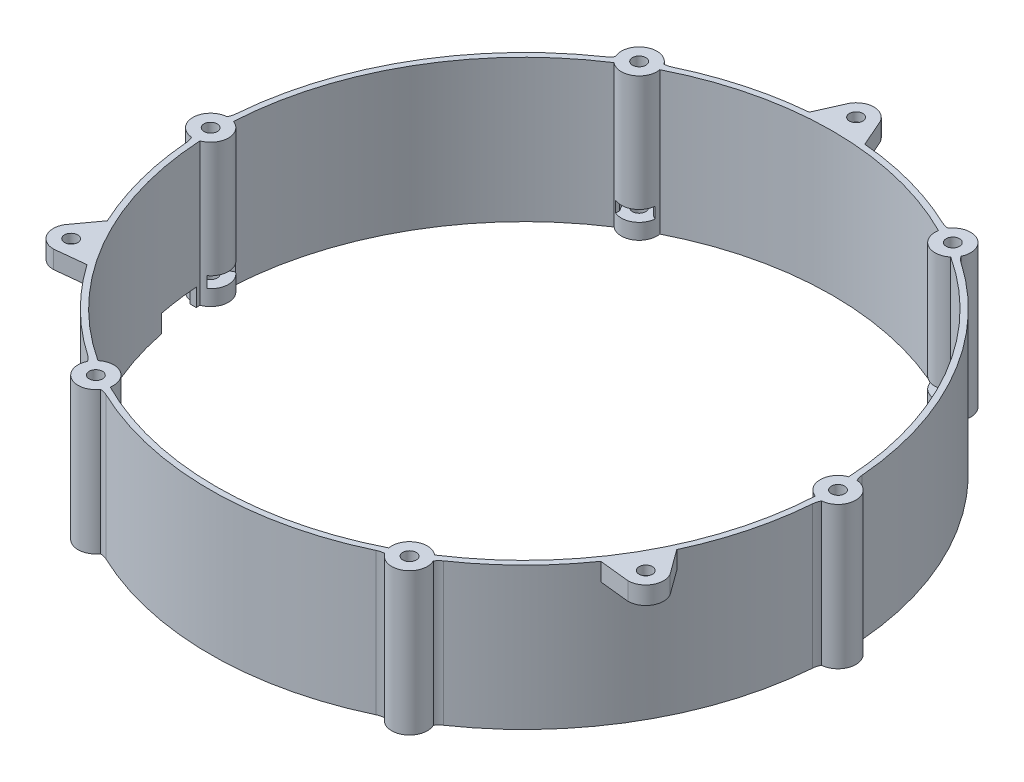
from build123d import *

# Parameters (mm, degrees)
SKETCH_1_R               = 1.5
SKETCH_1_R_2             = 4.5
EXTRUDE_1_DEPTH          = 4
FILLET_1_R               = 4
FILLET_2_R               = 4
EXTRUDE_START            = 5
EXTRUDE_2_DEPTH          = 5
CHAMFER_1_SIZE           = 0.5
EXTRUDE_START_2          = 10
SKETCH_3_R               = 1.5
EXTRUDE_3_DEPTH          = 10
CUT_EXTRUDE_1_DEPTH      = 7
CUT_EXTRUDE_1_DEPTH_BACK = 10
SKETCH_4_W               = 227.71066379
SKETCH_4_H               = 177.705724634
EXTRUDE_4_DEPTH          = 2.5
SKETCH_7_R               = 85.196987133
CUT_EXTRUDE_2_DEPTH      = 6.5
SKETCH_8_R               = 1.5
EXTRUDE_5_DEPTH          = 26
EXTRUDE_START_3          = -28
SKETCH_10_R              = 1.5
EXTRUDE_6_DEPTH          = 4
CUT_EXTRUDE_3_DEPTH      = 2
SKETCH_13_W              = 17.469611324
SKETCH_13_H              = 9
CUT_EXTRUDE_4_DEPTH      = 4


with BuildPart() as part:
    # 草图1 → 凸台-拉伸1 (new body)
    with BuildSketch(Plane(origin=(0, 0, 0), x_dir=(1, 0, 0), z_dir=(0, 1, 0))):
        with BuildLine():
            ThreePointArc((-70.5, 3), (-73.5, 0), (-70.5, -3))
            ThreePointArc((-70.5, -3), (-61.110044183, -35.281900459), (-37.848076211, -59.554790967))
            ThreePointArc((-37.848076211, -59.554790967), (-36.75, -63.652867178), (-32.651923789, -62.554790967))
            ThreePointArc((-32.651923789, -62.554790967), (0, -70.563800918), (32.651923789, -62.554790967))
            ThreePointArc((32.651923789, -62.554790967), (36.75, -63.652867178), (37.848076211, -59.554790967))
            ThreePointArc((37.848076211, -59.554790967), (61.110044183, -35.281900459), (70.5, -3))
            ThreePointArc((70.5, -3), (73.5, 0), (70.5, 3))
            ThreePointArc((70.5, 3), (61.110044183, 35.281900459), (37.848076211, 59.554790967))
            ThreePointArc((37.848076211, 59.554790967), (36.75, 63.652867178), (32.651923789, 62.554790967))
            ThreePointArc((32.651923789, 62.554790967), (0, 70.563800918), (-32.651923789, 62.554790967))
            ThreePointArc((-32.651923789, 62.554790967), (-36.75, 63.652867178), (-37.848076211, 59.554790967))
            ThreePointArc((-37.848076211, 59.554790967), (-61.110044183, 35.281900459), (-70.5, 3))
        make_face()
        with Locations(Location((-8, 0, 0), (0, 0, 270))):
            Circle(SKETCH_1_R, mode=Mode.SUBTRACT)
        with Locations(Location((0, 8, 0), (0, 0, 270))):
            Circle(SKETCH_1_R, mode=Mode.SUBTRACT)
        with Locations(Location((8, 0, 0), (0, 0, 270))):
            Circle(SKETCH_1_R, mode=Mode.SUBTRACT)
        with Locations(Location((0, -8, 0), (0, 0, 270))):
            Circle(SKETCH_1_R, mode=Mode.SUBTRACT)
        with Locations(Location((-70.5, 0, 0), (0, 0, 270))):
            Circle(SKETCH_1_R, mode=Mode.SUBTRACT)
        with Locations(Location((-35.25, 61.054790967, 0), (0, 0, 270))):
            Circle(SKETCH_1_R, mode=Mode.SUBTRACT)
        with Locations(Location((35.25, 61.054790967, 0), (0, 0, 270))):
            Circle(SKETCH_1_R, mode=Mode.SUBTRACT)
        with Locations(Location((70.5, 0, 0), (0, 0, 270))):
            Circle(SKETCH_1_R, mode=Mode.SUBTRACT)
        with Locations(Location((35.25, -61.054790967, 0), (0, 0, 270))):
            Circle(SKETCH_1_R, mode=Mode.SUBTRACT)
        with Locations(Location((-35.25, -61.054790967, 0), (0, 0, 270))):
            Circle(SKETCH_1_R, mode=Mode.SUBTRACT)
        with Locations(Location((0, 0, 0), (0, 0, 270))):
            Circle(SKETCH_1_R_2, mode=Mode.SUBTRACT)
        with BuildLine():
            Line((-9.579036496, 4.300239505), (-67.362882511, 4.300239505))
            ThreePointArc((-67.362882511, 4.300239505), (-58.456714755, 33.75), (-37.405557909, 56.187847774))
            Line((-37.405557909, 56.187847774), (-8.513634902, 6.145569197))
            ThreePointArc((-8.513634902, 6.145569197), (-9.09326674, 5.25), (-9.579036496, 4.300239505))
        make_face(mode=Mode.SUBTRACT)
        with BuildLine():
            Line((-9.579036496, -4.300239505), (-67.362882511, -4.300239505))
            ThreePointArc((-67.362882511, -4.300239505), (-58.456714755, -33.75), (-37.405557909, -56.187847774))
            Line((-37.405557909, -56.187847774), (-8.513634902, -6.145569197))
            ThreePointArc((-8.513634902, -6.145569197), (-9.09326674, -5.25), (-9.579036496, -4.300239505))
        make_face(mode=Mode.SUBTRACT)
        with BuildLine():
            Line((67.362882511, -4.300239505), (9.579036496, -4.300239505))
            ThreePointArc((9.579036496, -4.300239505), (9.09326674, -5.25), (8.513634902, -6.145569197))
            Line((8.513634902, -6.145569197), (37.405557909, -56.187847774))
            ThreePointArc((37.405557909, -56.187847774), (58.456714755, -33.75), (67.362882511, -4.300239505))
        make_face(mode=Mode.SUBTRACT)
        with BuildLine():
            Line((67.362882511, 4.300239505), (9.579036496, 4.300239505))
            ThreePointArc((9.579036496, 4.300239505), (9.09326674, 5.25), (8.513634902, 6.145569197))
            Line((8.513634902, 6.145569197), (37.405557909, 56.187847774))
            ThreePointArc((37.405557909, 56.187847774), (58.456714755, 33.75), (67.362882511, 4.300239505))
        make_face(mode=Mode.SUBTRACT)
        with BuildLine():
            Line((-1.065401594, 10.445808702), (-29.957324602, 60.488087279))
            ThreePointArc((-29.957324602, 60.488087279), (0, 67.5), (29.957324602, 60.488087279))
            Line((29.957324602, 60.488087279), (1.065401594, 10.445808702))
            ThreePointArc((1.065401594, 10.445808702), (0, 10.5), (-1.065401594, 10.445808702))
        make_face(mode=Mode.SUBTRACT)
        with BuildLine():
            Line((29.957324602, -60.488087279), (1.065401594, -10.445808702))
            ThreePointArc((1.065401594, -10.445808702), (0, -10.5), (-1.065401594, -10.445808702))
            Line((-1.065401594, -10.445808702), (-29.957324602, -60.488087279))
            ThreePointArc((-29.957324602, -60.488087279), (0, -67.5), (29.957324602, -60.488087279))
        make_face(mode=Mode.SUBTRACT)
        with BuildLine():
            Line((-32.799038106, -53.809600438), (-7.799038106, -10.508330249))
            ThreePointArc((-7.799038106, -10.508330249), (-5.75, -9.959292144), (-5.200961894, -12.008330249))
            Line((-5.200961894, -12.008330249), (-30.200961894, -55.309600438))
            ThreePointArc((-30.200961894, -55.309600438), (-32.25, -55.858638544), (-32.799038106, -53.809600438))
        make_face(mode=Mode.SUBTRACT)
        with BuildLine():
            Line((-63, 1.5), (-13, 1.5))
            ThreePointArc((-13, 1.5), (-11.5, 0), (-13, -1.5))
            Line((-13, -1.5), (-63, -1.5))
            ThreePointArc((-63, -1.5), (-64.5, 0), (-63, 1.5))
        make_face(mode=Mode.SUBTRACT)
        with BuildLine():
            Line((-30.200961894, 55.309600438), (-5.200961894, 12.008330249))
            ThreePointArc((-5.200961894, 12.008330249), (-5.75, 9.959292144), (-7.799038106, 10.508330249))
            Line((-7.799038106, 10.508330249), (-32.799038106, 53.809600438))
            ThreePointArc((-32.799038106, 53.809600438), (-32.25, 55.858638544), (-30.200961894, 55.309600438))
        make_face(mode=Mode.SUBTRACT)
        with BuildLine():
            Line((32.799038106, 53.809600438), (7.799038106, 10.508330249))
            ThreePointArc((7.799038106, 10.508330249), (5.75, 9.959292144), (5.200961894, 12.008330249))
            Line((5.200961894, 12.008330249), (30.200961894, 55.309600438))
            ThreePointArc((30.200961894, 55.309600438), (32.25, 55.858638544), (32.799038106, 53.809600438))
        make_face(mode=Mode.SUBTRACT)
        with BuildLine():
            Line((63, -1.5), (13, -1.5))
            ThreePointArc((13, -1.5), (11.5, 0), (13, 1.5))
            Line((13, 1.5), (63, 1.5))
            ThreePointArc((63, 1.5), (64.5, 0), (63, -1.5))
        make_face(mode=Mode.SUBTRACT)
        with BuildLine():
            Line((30.200961894, -55.309600438), (5.200961894, -12.008330249))
            ThreePointArc((5.200961894, -12.008330249), (5.75, -9.959292144), (7.799038106, -10.508330249))
            Line((7.799038106, -10.508330249), (32.799038106, -53.809600438))
            ThreePointArc((32.799038106, -53.809600438), (32.25, -55.858638544), (30.200961894, -55.309600438))
        make_face(mode=Mode.SUBTRACT)
    extrude(amount=EXTRUDE_1_DEPTH)

    # 圆角1
    fillet_1_edges = [part.edges().sort_by_distance(p)[0] for p in [
        (-32.651923789, 2, -62.554790967),
        (32.651923789, 2, -62.554790967),
        (37.848076211, 2, -59.554790967),
        (70.5, 2, -3),
        (70.5, 2, 3),
        (37.848076211, 2, 59.554790967),
        (32.651923789, 2, 62.554790967),
        (-32.651923789, 2, 62.554790967),
        (-37.848076211, 2, 59.554790967),
        (-70.5, 2, 3),
        (-70.5, 2, -3),
        (-37.848076211, 2, -59.554790967),
        (29.957324602, 2, 60.488087279),
        (-29.957324602, 2, 60.488087279),
        (67.362882511, 2, 4.300239505),
        (37.405557909, 2, 56.187847774),
        (37.405557909, 2, -56.187847774),
        (67.362882511, 2, -4.300239505),
        (-29.957324602, 2, -60.488087279),
        (29.957324602, 2, -60.488087279),
        (-67.362882511, 2, -4.300239505),
        (-37.405557909, 2, -56.187847774),
        (-67.362882511, 2, 4.300239505),
        (-37.405557909, 2, 56.187847774),
    ]]
    fillet(fillet_1_edges, radius=FILLET_1_R)

    # 圆角2
    # the kernel refuses this fillet: 4 mm, written as the material it adds along each edge
    with BuildSketch(Plane(origin=(-1.065401594, 0, 10.445808702), x_dir=(-0.5000000000000071, 0, 0.8660254037844346), z_dir=(0, 1, 0)), Plane(origin=(-9.579036496, 0, 4.300239505), x_dir=(-1, 0, 0), z_dir=(0, 1, 0)), Plane(origin=(-8.513634902, 0, -6.145569197), x_dir=(-0.4999999999999958, 0, -0.866025403784441), z_dir=(0, 1, 0)), Plane(origin=(1.065401594, 0, -10.445808702), x_dir=(0.5000000000000073, 0, -0.8660254037844344), z_dir=(0, 1, 0)), Plane(origin=(9.579036496, 0, -4.300239505), x_dir=(1, 0, 0), z_dir=(0, 1, 0)), Plane(origin=(8.513634902, 0, 6.145569197), x_dir=(0.4999999999999941, 0, 0.866025403784442), z_dir=(0, 1, 0))) as fillet_2_piece_1:
        with BuildLine():
            CenterArc((2.310287461, 4), FILLET_2_R, 214.919873181, 55.080126819)
            ThreePointArc((-0.969526045, 1.710278757), (-0.444646896, 0.877880484), (0, 0))
            Line((0, 0), (2.310287461, 0))
        make_face()
    extrude(amount=4)
    with BuildSketch(Plane(origin=(-8.513634902, 0, 6.145569197), x_dir=(-0.5068146140540679, 0, -0.8620550718957729), z_dir=(0, 1, 0)), Plane(origin=(-9.579036496, 0, -4.300239505), x_dir=(0.49315428469593503, 0, -0.86994186672791), z_dir=(0, 1, 0)), Plane(origin=(-1.065401594, 0, -10.445808702), x_dir=(0.9999688987499935, 0, -0.007886794832196306), z_dir=(0, 1, 0)), Plane(origin=(8.513634902, 0, -6.145569197), x_dir=(0.5068146140541091, 0, 0.8620550718957487), z_dir=(0, 1, 0)), Plane(origin=(9.579036496, 0, 4.300239505), x_dir=(-0.49315428469592015, 0, 0.8699418667279183), z_dir=(0, 1, 0))) as fillet_2_piece_2:
        with BuildLine():
            CenterArc((2.340439307, 3.982432925), FILLET_2_R, 209.548115257, 55.080126819)
            Line((-1.13932816, 2.009815786), (0, 0))
            ThreePointArc((0, 0), (0.982984509, 0.046113572), (1.965969018, 0))
        make_face()
    extrude(amount=4)
    with BuildSketch(Plane(origin=(1.065401594, 0, 10.445808702), x_dir=(0.4999999999999959, 0, 0.8660254037844409), z_dir=(0, 1, 0))) as fillet_2_piece_3:
        with BuildLine():
            CenterArc((2.310287461, -4), FILLET_2_R, 90, 55.080126819)
            ThreePointArc((-0.969526045, -1.710278757), (-0.444646896, -0.877880484), (0, 0))
            Line((0, 0), (2.310287461, 0))
        make_face()
    extrude(amount=4)

    # 草图2 → 凸台-拉伸2 (add)
    with BuildSketch(Plane(origin=(0, 0, 0), x_dir=(-1, 0, 0), z_dir=(0, -1, 0)).offset(EXTRUDE_START)):
        with BuildLine():
            Line((23.086359674, -63.429251903), (23.599389889, -64.838790834))
            ThreePointArc((23.599389889, -64.838790834), (0, -69), (-23.599389889, -64.838790834))
            Line((-23.599389889, -64.838790834), (-23.086359674, -63.429251903))
            ThreePointArc((-23.086359674, -63.429251903), (0, -67.5), (23.086359674, -63.429251903))
        make_face()
        with BuildLine():
            Line((-43.388163654, -51.707999911), (-44.352345068, -52.857066575))
            ThreePointArc((-44.352345068, -52.857066575), (-59.755752861, -34.5), (-67.951734958, -11.981724259))
            Line((-67.951734958, -11.981724259), (-66.474523328, -11.721251993))
            ThreePointArc((-66.474523328, -11.721251993), (-58.456714755, -33.75), (-43.388163654, -51.707999911))
        make_face()
        with BuildLine():
            Line((-66.474523328, 11.721251993), (-67.951734958, 11.981724259))
            ThreePointArc((-67.951734958, 11.981724259), (-59.755752861, 34.5), (-44.352345068, 52.857066575))
            Line((-44.352345068, 52.857066575), (-43.388163654, 51.707999911))
            ThreePointArc((-43.388163654, 51.707999911), (-58.456714755, 33.75), (-66.474523328, 11.721251993))
        make_face()
        with BuildLine():
            Line((-23.086359674, 63.429251903), (-23.599389889, 64.838790834))
            ThreePointArc((-23.599389889, 64.838790834), (0, 69), (23.599389889, 64.838790834))
            Line((23.599389889, 64.838790834), (23.086359674, 63.429251903))
            ThreePointArc((23.086359674, 63.429251903), (0, 67.5), (-23.086359674, 63.429251903))
        make_face()
        with BuildLine():
            Line((43.388163654, 51.707999911), (44.352345068, 52.857066575))
            ThreePointArc((44.352345068, 52.857066575), (59.755752861, 34.5), (67.951734958, 11.981724259))
            Line((67.951734958, 11.981724259), (66.474523328, 11.721251993))
            ThreePointArc((66.474523328, 11.721251993), (58.456714755, 33.75), (43.388163654, 51.707999911))
        make_face()
        with BuildLine():
            Line((66.474523328, -11.721251993), (67.951734958, -11.981724259))
            ThreePointArc((67.951734958, -11.981724259), (59.755752861, -34.5), (44.352345068, -52.857066575))
            Line((44.352345068, -52.857066575), (43.388163654, -51.707999911))
            ThreePointArc((43.388163654, -51.707999911), (58.456714755, -33.75), (66.474523328, -11.721251993))
        make_face()
    extrude(amount=-EXTRUDE_2_DEPTH)

    # 倒角1
    chamfer_1_edges = [part.edges().sort_by_distance(p)[0] for p in [
        (0, -5, 69),
        (59.755752861, -5, 34.5),
        (59.755752861, -5, -34.5),
        (0, -5, -69),
        (-59.755752861, -5, -34.5),
        (-59.755752861, -5, 34.5),
    ]]
    chamfer(chamfer_1_edges, length=CHAMFER_1_SIZE)

    # 草图4 → 切除-拉伸1 (cut, two sides: drawn at the far end of the back side and taken through both)
    with BuildSketch(Plane(origin=(0, 0, 0), x_dir=(-1, 0, 0), z_dir=(0, -1, 0)).offset(-CUT_EXTRUDE_1_DEPTH_BACK)):
        Rectangle(SKETCH_4_W, SKETCH_4_H)
    extrude(amount=CUT_EXTRUDE_1_DEPTH + CUT_EXTRUDE_1_DEPTH_BACK, mode=Mode.SUBTRACT)


with BuildPart() as body_2:
    # 草图3 → 凸台-拉伸3 (new body)
    with BuildSketch(Plane.XZ.offset(EXTRUDE_START_2)):
        with BuildLine():
            ThreePointArc((70.796400557, -3.989003223), (74.5, 0), (70.796400557, 3.989003223))
            ThreePointArc((70.796400557, 3.989003223), (70.49170404, 4.742901972), (70.345766695, 5.542842958))
            ThreePointArc((70.345766695, 5.542842958), (61.110044183, 35.281900459), (39.973126159, 58.149799528))
            ThreePointArc((39.973126159, 58.149799528), (39.353325615, 58.676155469), (38.852778405, 59.316979767))
            ThreePointArc((38.852778405, 59.316979767), (37.25, 64.518892582), (31.943622152, 63.30598299))
            ThreePointArc((31.943622152, 63.30598299), (31.138378425, 63.419057441), (30.372640536, 63.692642486))
            ThreePointArc((30.372640536, 63.692642486), (0, 70.563800918), (-30.372640536, 63.692642486))
            ThreePointArc((-30.372640536, 63.692642486), (-31.138378425, 63.419057441), (-31.943622152, 63.30598299))
            ThreePointArc((-31.943622152, 63.30598299), (-37.25, 64.518892582), (-38.852778405, 59.316979767))
            ThreePointArc((-38.852778405, 59.316979767), (-39.353325615, 58.676155469), (-39.973126159, 58.149799528))
            ThreePointArc((-39.973126159, 58.149799528), (-61.110044183, 35.281900459), (-70.345766695, 5.542842958))
            ThreePointArc((-70.345766695, 5.542842958), (-70.49170404, 4.742901972), (-70.796400557, 3.989003223))
            ThreePointArc((-70.796400557, 3.989003223), (-74.5, 0), (-70.796400557, -3.989003223))
            ThreePointArc((-70.796400557, -3.989003223), (-70.49170404, -4.742901972), (-70.345766695, -5.542842958))
            ThreePointArc((-70.345766695, -5.542842958), (-61.110044183, -35.281900459), (-39.973126159, -58.149799528))
            ThreePointArc((-39.973126159, -58.149799528), (-39.353325615, -58.676155469), (-38.852778405, -59.316979767))
            ThreePointArc((-38.852778405, -59.316979767), (-37.25, -64.518892582), (-31.943622152, -63.30598299))
            ThreePointArc((-31.943622152, -63.30598299), (-31.138378425, -63.419057441), (-30.372640536, -63.692642486))
            ThreePointArc((-30.372640536, -63.692642486), (0, -70.563800918), (30.372640536, -63.692642486))
            ThreePointArc((30.372640536, -63.692642486), (31.138378425, -63.419057441), (31.943622152, -63.30598299))
            ThreePointArc((31.943622152, -63.30598299), (37.25, -64.518892582), (38.852778405, -59.316979767))
            ThreePointArc((38.852778405, -59.316979767), (39.353325615, -58.676155469), (39.973126159, -58.149799528))
            ThreePointArc((39.973126159, -58.149799528), (61.110044183, -35.281900459), (70.345766695, -5.542842958))
            ThreePointArc((70.345766695, -5.542842958), (70.49170404, -4.742901972), (70.796400557, -3.989003223))
        make_face()
        with Locations(Location((70.5, 0, 0), (0, 0, 270))):
            Circle(SKETCH_3_R, mode=Mode.SUBTRACT)
        with Locations(Location((35.25, 61.054790967, 0), (0, 0, 270))):
            Circle(SKETCH_3_R, mode=Mode.SUBTRACT)
        with Locations(Location((-35.25, 61.054790967, 0), (0, 0, 270))):
            Circle(SKETCH_3_R, mode=Mode.SUBTRACT)
        with Locations(Location((-70.5, 0, 0), (0, 0, 270))):
            Circle(SKETCH_3_R, mode=Mode.SUBTRACT)
        with Locations(Location((-35.25, -61.054790967, 0), (0, 0, 270))):
            Circle(SKETCH_3_R, mode=Mode.SUBTRACT)
        with Locations(Location((35.25, -61.054790967, 0), (0, 0, 270))):
            Circle(SKETCH_3_R, mode=Mode.SUBTRACT)
        with BuildLine():
            ThreePointArc((-37.833906507, 58.001362212), (-59.972259212, 34.625), (-69.147606383, 3.764443054))
            ThreePointArc((-69.147606383, 3.764443054), (-66.5, 0), (-69.147606383, -3.764443054))
            ThreePointArc((-69.147606383, -3.764443054), (-59.972259212, -34.625), (-37.833906507, -58.001362212))
            ThreePointArc((-37.833906507, -58.001362212), (-33.25, -57.590689352), (-31.313699876, -61.765805265))
            ThreePointArc((-31.313699876, -61.765805265), (0, -69.25), (31.313699876, -61.765805265))
            ThreePointArc((31.313699876, -61.765805265), (33.25, -57.590689352), (37.833906507, -58.001362212))
            ThreePointArc((37.833906507, -58.001362212), (59.972259212, -34.625), (69.147606383, -3.764443054))
            ThreePointArc((69.147606383, -3.764443054), (66.5, 0), (69.147606383, 3.764443054))
            ThreePointArc((69.147606383, 3.764443054), (59.972259212, 34.625), (37.833906507, 58.001362212))
            ThreePointArc((37.833906507, 58.001362212), (33.25, 57.590689352), (31.313699876, 61.765805265))
            ThreePointArc((31.313699876, 61.765805265), (0, 69.25), (-31.313699876, 61.765805265))
            ThreePointArc((-31.313699876, 61.765805265), (-33.25, 57.590689352), (-37.833906507, 58.001362212))
        make_face(mode=Mode.SUBTRACT)
    extrude(amount=EXTRUDE_3_DEPTH)

    # 草图5 → 凸台-拉伸4 (add)
    with BuildSketch(Plane(origin=(0, -10, 0), x_dir=(1, 0, 0), z_dir=(0, 1, 0))):
        with BuildLine():
            ThreePointArc((30.372640536, 63.692642486), (0, 70.563800918), (-30.372640536, 63.692642486))
            ThreePointArc((-30.372640536, 63.692642486), (-31.138378425, 63.419057441), (-31.943622152, 63.30598299))
            ThreePointArc((-31.943622152, 63.30598299), (-37.25, 64.518892582), (-38.852778405, 59.316979767))
            ThreePointArc((-38.852778405, 59.316979767), (-39.353325615, 58.676155469), (-39.973126159, 58.149799528))
            ThreePointArc((-39.973126159, 58.149799528), (-61.110044183, 35.281900459), (-70.345766695, 5.542842958))
            ThreePointArc((-70.345766695, 5.542842958), (-70.49170404, 4.742901972), (-70.796400557, 3.989003223))
            ThreePointArc((-70.796400557, 3.989003223), (-74.5, 0), (-70.796400557, -3.989003223))
            ThreePointArc((-70.796400557, -3.989003223), (-70.49170404, -4.742901972), (-70.345766695, -5.542842958))
            ThreePointArc((-70.345766695, -5.542842958), (-61.110044183, -35.281900459), (-39.973126159, -58.149799528))
            ThreePointArc((-39.973126159, -58.149799528), (-39.353325615, -58.676155469), (-38.852778405, -59.316979767))
            ThreePointArc((-38.852778405, -59.316979767), (-37.25, -64.518892582), (-31.943622152, -63.30598299))
            ThreePointArc((-31.943622152, -63.30598299), (-31.138378425, -63.419057441), (-30.372640536, -63.692642486))
            ThreePointArc((-30.372640536, -63.692642486), (0, -70.563800918), (30.372640536, -63.692642486))
            ThreePointArc((30.372640536, -63.692642486), (31.138378425, -63.419057441), (31.943622152, -63.30598299))
            ThreePointArc((31.943622152, -63.30598299), (37.25, -64.518892582), (38.852778405, -59.316979767))
            ThreePointArc((38.852778405, -59.316979767), (39.353325615, -58.676155469), (39.973126159, -58.149799528))
            ThreePointArc((39.973126159, -58.149799528), (61.110044183, -35.281900459), (70.345766695, -5.542842958))
            ThreePointArc((70.345766695, -5.542842958), (70.49170404, -4.742901972), (70.796400557, -3.989003223))
            ThreePointArc((70.796400557, -3.989003223), (74.5, 0), (70.796400557, 3.989003223))
            ThreePointArc((70.796400557, 3.989003223), (70.49170404, 4.742901972), (70.345766695, 5.542842958))
            ThreePointArc((70.345766695, 5.542842958), (61.110044183, 35.281900459), (39.973126159, 58.149799528))
            ThreePointArc((39.973126159, 58.149799528), (39.353325615, 58.676155469), (38.852778405, 59.316979767))
            ThreePointArc((38.852778405, 59.316979767), (37.25, 64.518892582), (31.943622152, 63.30598299))
            ThreePointArc((31.943622152, 63.30598299), (31.138378425, 63.419057441), (30.372640536, 63.692642486))
        make_face()
        with BuildLine():
            Line((-32.016838493, 61.054790967), (-33.633419246, 63.854790967))
            Line((-33.633419246, 63.854790967), (-36.866580754, 63.854790967))
            Line((-36.866580754, 63.854790967), (-38.483161507, 61.054790967))
            Line((-38.483161507, 61.054790967), (-36.866580754, 58.254790967))
            Line((-36.866580754, 58.254790967), (-36.866580754, 57.396011571))
            ThreePointArc((-36.866580754, 57.396011571), (-37.371941483, 57.664014604), (-37.833906507, 58.001362212))
            ThreePointArc((-37.833906507, 58.001362212), (-59.972259212, 34.625), (-69.147606383, 3.764443054))
            ThreePointArc((-69.147606383, 3.764443054), (-68.624472273, 3.533043411), (-68.139694473, 3.229389698))
            Line((-68.139694473, 3.229389698), (-68.883419246, 2.8))
            Line((-68.883419246, 2.8), (-72.116580754, 2.8))
            Line((-72.116580754, 2.8), (-73.733161507, 0))
            Line((-73.733161507, 0), (-72.116580754, -2.8))
            Line((-72.116580754, -2.8), (-68.883419246, -2.8))
            Line((-68.883419246, -2.8), (-68.139694473, -3.229389698))
            ThreePointArc((-68.139694473, -3.229389698), (-68.624472273, -3.533043411), (-69.147606383, -3.764443054))
            ThreePointArc((-69.147606383, -3.764443054), (-59.972259212, -34.625), (-37.833906507, -58.001362212))
            ThreePointArc((-37.833906507, -58.001362212), (-37.371941483, -57.664014604), (-36.866580754, -57.396011571))
            Line((-36.866580754, -57.396011571), (-36.866580754, -58.254790967))
            Line((-36.866580754, -58.254790967), (-38.483161507, -61.054790967))
            Line((-38.483161507, -61.054790967), (-36.866580754, -63.854790967))
            Line((-36.866580754, -63.854790967), (-33.633419246, -63.854790967))
            Line((-33.633419246, -63.854790967), (-32.016838493, -61.054790967))
            Line((-32.016838493, -61.054790967), (-31.27311372, -60.625401269))
            ThreePointArc((-31.27311372, -60.625401269), (-31.25253079, -61.197058015), (-31.313699876, -61.765805265))
            ThreePointArc((-31.313699876, -61.765805265), (0, -69.25), (31.313699876, -61.765805265))
            ThreePointArc((31.313699876, -61.765805265), (31.25253079, -61.197058015), (31.27311372, -60.625401269))
            Line((31.27311372, -60.625401269), (32.016838493, -61.054790967))
            Line((32.016838493, -61.054790967), (33.633419246, -63.854790967))
            Line((33.633419246, -63.854790967), (36.866580754, -63.854790967))
            Line((36.866580754, -63.854790967), (38.483161507, -61.054790967))
            Line((38.483161507, -61.054790967), (36.866580754, -58.254790967))
            Line((36.866580754, -58.254790967), (36.866580754, -57.396011571))
            ThreePointArc((36.866580754, -57.396011571), (37.371941483, -57.664014604), (37.833906507, -58.001362212))
            ThreePointArc((37.833906507, -58.001362212), (59.972259212, -34.625), (69.147606383, -3.764443054))
            ThreePointArc((69.147606383, -3.764443054), (68.624472273, -3.533043411), (68.139694473, -3.229389698))
            Line((68.139694473, -3.229389698), (68.883419246, -2.8))
            Line((68.883419246, -2.8), (72.116580754, -2.8))
            Line((72.116580754, -2.8), (73.733161507, 0))
            Line((73.733161507, 0), (72.116580754, 2.8))
            Line((72.116580754, 2.8), (68.883419246, 2.8))
            Line((68.883419246, 2.8), (68.139694473, 3.229389698))
            ThreePointArc((68.139694473, 3.229389698), (68.624472273, 3.533043411), (69.147606383, 3.764443054))
            ThreePointArc((69.147606383, 3.764443054), (59.972259212, 34.625), (37.833906507, 58.001362212))
            ThreePointArc((37.833906507, 58.001362212), (37.371941483, 57.664014604), (36.866580754, 57.396011571))
            Line((36.866580754, 57.396011571), (36.866580754, 58.254790967))
            Line((36.866580754, 58.254790967), (38.483161507, 61.054790967))
            Line((38.483161507, 61.054790967), (36.866580754, 63.854790967))
            Line((36.866580754, 63.854790967), (33.633419246, 63.854790967))
            Line((33.633419246, 63.854790967), (32.016838493, 61.054790967))
            Line((32.016838493, 61.054790967), (31.27311372, 60.625401269))
            ThreePointArc((31.27311372, 60.625401269), (31.25253079, 61.197058015), (31.313699876, 61.765805265))
            ThreePointArc((31.313699876, 61.765805265), (0, 69.25), (-31.313699876, 61.765805265))
            ThreePointArc((-31.313699876, 61.765805265), (-31.25253079, 61.197058015), (-31.27311372, 60.625401269))
            Line((-31.27311372, 60.625401269), (-32.016838493, 61.054790967))
        make_face(mode=Mode.SUBTRACT)
    extrude(amount=EXTRUDE_4_DEPTH)

    # 草图7 → 切除-拉伸2 (cut)
    with BuildSketch(Plane(origin=(0, -20, 0), x_dir=(-1, 0, 0), z_dir=(0, -1, 0))):
        Circle(SKETCH_7_R)
    extrude(amount=-CUT_EXTRUDE_2_DEPTH, mode=Mode.SUBTRACT)

    # 草图8 → 凸台-拉伸5 (add)
    with BuildSketch(Plane(origin=(0, -7.5, 0), x_dir=(1, 0, 0), z_dir=(0, 1, 0))):
        with BuildLine():
            ThreePointArc((38.852778405, 59.316979767), (39.353325615, 58.676155469), (39.973126159, 58.149799528))
            ThreePointArc((39.973126159, 58.149799528), (61.110044183, 35.281900459), (70.345766695, 5.542842958))
            ThreePointArc((70.345766695, 5.542842958), (70.49170404, 4.742901972), (70.796400557, 3.989003223))
            ThreePointArc((70.796400557, 3.989003223), (74.5, 0), (70.796400557, -3.989003223))
            ThreePointArc((70.796400557, -3.989003223), (70.49170404, -4.742901972), (70.345766695, -5.542842958))
            ThreePointArc((70.345766695, -5.542842958), (61.110044183, -35.281900459), (39.973126159, -58.149799528))
            ThreePointArc((39.973126159, -58.149799528), (39.353325615, -58.676155469), (38.852778405, -59.316979767))
            ThreePointArc((38.852778405, -59.316979767), (37.25, -64.518892582), (31.943622152, -63.30598299))
            ThreePointArc((31.943622152, -63.30598299), (31.138378425, -63.419057441), (30.372640536, -63.692642486))
            ThreePointArc((30.372640536, -63.692642486), (0, -70.563800918), (-30.372640536, -63.692642486))
            ThreePointArc((-30.372640536, -63.692642486), (-31.138378425, -63.419057441), (-31.943622152, -63.30598299))
            ThreePointArc((-31.943622152, -63.30598299), (-37.25, -64.518892582), (-38.852778405, -59.316979767))
            ThreePointArc((-38.852778405, -59.316979767), (-39.353325615, -58.676155469), (-39.973126159, -58.149799528))
            ThreePointArc((-39.973126159, -58.149799528), (-61.110044183, -35.281900459), (-70.345766695, -5.542842958))
            ThreePointArc((-70.345766695, -5.542842958), (-70.49170404, -4.742901972), (-70.796400557, -3.989003223))
            ThreePointArc((-70.796400557, -3.989003223), (-74.5, 0), (-70.796400557, 3.989003223))
            ThreePointArc((-70.796400557, 3.989003223), (-70.49170404, 4.742901972), (-70.345766695, 5.542842958))
            ThreePointArc((-70.345766695, 5.542842958), (-61.110044183, 35.281900459), (-39.973126159, 58.149799528))
            ThreePointArc((-39.973126159, 58.149799528), (-39.353325615, 58.676155469), (-38.852778405, 59.316979767))
            ThreePointArc((-38.852778405, 59.316979767), (-37.25, 64.518892582), (-31.943622152, 63.30598299))
            ThreePointArc((-31.943622152, 63.30598299), (-31.138378425, 63.419057441), (-30.372640536, 63.692642486))
            ThreePointArc((-30.372640536, 63.692642486), (0, 70.563800918), (30.372640536, 63.692642486))
            ThreePointArc((30.372640536, 63.692642486), (31.138378425, 63.419057441), (31.943622152, 63.30598299))
            ThreePointArc((31.943622152, 63.30598299), (37.25, 64.518892582), (38.852778405, 59.316979767))
        make_face()
        with Locations(Location((-70.5, 0, 0), (0, 0, 90))):
            Circle(SKETCH_8_R, mode=Mode.SUBTRACT)
        with Locations(Location((-35.25, 61.054790967, 0), (0, 0, 90))):
            Circle(SKETCH_8_R, mode=Mode.SUBTRACT)
        with Locations(Location((35.25, 61.054790967, 0), (0, 0, 90))):
            Circle(SKETCH_8_R, mode=Mode.SUBTRACT)
        with Locations(Location((70.5, 0, 0), (0, 0, 90))):
            Circle(SKETCH_8_R, mode=Mode.SUBTRACT)
        with Locations(Location((35.25, -61.054790967, 0), (0, 0, 90))):
            Circle(SKETCH_8_R, mode=Mode.SUBTRACT)
        with Locations(Location((-35.25, -61.054790967, 0), (0, 0, 89.999999999))):
            Circle(SKETCH_8_R, mode=Mode.SUBTRACT)
        with BuildLine():
            ThreePointArc((-69.147606383, -3.764443054), (-59.972259212, -34.625), (-37.833906507, -58.001362212))
            ThreePointArc((-37.833906507, -58.001362212), (-33.25, -57.590689352), (-31.313699876, -61.765805265))
            ThreePointArc((-31.313699876, -61.765805265), (0, -69.25), (31.313699876, -61.765805265))
            ThreePointArc((31.313699876, -61.765805265), (33.25, -57.590689352), (37.833906507, -58.001362212))
            ThreePointArc((37.833906507, -58.001362212), (59.972259212, -34.625), (69.147606383, -3.764443054))
            ThreePointArc((69.147606383, -3.764443054), (66.5, 0), (69.147606383, 3.764443054))
            ThreePointArc((69.147606383, 3.764443054), (59.972259212, 34.625), (37.833906507, 58.001362212))
            ThreePointArc((37.833906507, 58.001362212), (33.25, 57.590689352), (31.313699876, 61.765805265))
            ThreePointArc((31.313699876, 61.765805265), (0, 69.25), (-31.313699876, 61.765805265))
            ThreePointArc((-31.313699876, 61.765805265), (-33.25, 57.590689352), (-37.833906507, 58.001362212))
            ThreePointArc((-37.833906507, 58.001362212), (-59.972259212, 34.625), (-69.147606383, 3.764443054))
            ThreePointArc((-69.147606383, 3.764443054), (-66.5, 0), (-69.147606383, -3.764443054))
        make_face(mode=Mode.SUBTRACT)
    extrude(amount=EXTRUDE_5_DEPTH)

    # 草图10 → 凸台-拉伸6 (add)
    # profile 1 of 3: a face of its own
    with BuildSketch(Plane(origin=(0, -13.5, 0), x_dir=(-1, 0, 0), z_dir=(0, -1, 0)).offset(EXTRUDE_START_3)):
        with BuildLine():
            Line((-64.574145798, -41.281900459), (-57.744339232, -40.556642941))
            ThreePointArc((-57.744339232, -40.556642941), (-61.110044183, -35.281900459), (-63.995252695, -29.729743229))
            Line((-63.995252695, -29.729743229), (-68.038247413, -35.281900459))
            ThreePointArc((-68.038247413, -35.281900459), (-68.038247413, -39.281900459), (-64.574145798, -41.281900459))
        make_face()
        with Locations(Location((-64.574145798, -37.281900459, 0), (0, 0, 90))):
            Circle(SKETCH_10_R, mode=Mode.SUBTRACT)
    # profile 2 of 3: a face of its own
    with BuildSketch(Plane(origin=(0, -13.5, 0), x_dir=(-1, 0, 0), z_dir=(0, -1, 0)).offset(EXTRUDE_START_3)):
        with BuildLine():
            Line((-3.464101615, 76.563800918), (-6.250913463, 70.28638617))
            ThreePointArc((-6.250913463, 70.28638617), (0, 70.563800918), (6.250913463, 70.28638617))
            Line((6.250913463, 70.28638617), (3.464101615, 76.563800918))
            ThreePointArc((3.464101615, 76.563800918), (0, 78.563800918), (-3.464101615, 76.563800918))
        make_face()
        with Locations(Location((0, 74.563800918, 0), (0, 0, 90))):
            Circle(SKETCH_10_R, mode=Mode.SUBTRACT)
    # profile 3 of 3: a face of its own
    with BuildSketch(Plane(origin=(0, -13.5, 0), x_dir=(-1, 0, 0), z_dir=(0, -1, 0)).offset(EXTRUDE_START_3)):
        with BuildLine():
            Line((68.038247413, -35.281900459), (63.995252695, -29.729743229))
            ThreePointArc((63.995252695, -29.729743229), (61.110044183, -35.281900459), (57.744339232, -40.556642941))
            Line((57.744339232, -40.556642941), (64.574145798, -41.281900459))
            ThreePointArc((64.574145798, -41.281900459), (68.038247413, -39.281900459), (68.038247413, -35.281900459))
        make_face()
        with Locations(Location((64.574145798, -37.281900459, 0), (0, 0, 90))):
            Circle(SKETCH_10_R, mode=Mode.SUBTRACT)
    extrude(amount=-EXTRUDE_6_DEPTH)

    # 草图12 → 切除-拉伸3 (cut)
    with BuildSketch(Plane.XZ.offset(-14.5)):
        Polygon((-67.374145798, 38.898481213), (-67.374145798, 35.665319705), (-64.574145798, 34.048738952), (-61.774145798, 35.665319705), (-61.774145798, 38.898481213), (-64.574145798, 40.515061966), align=None)
        Polygon((67.374145798, 38.898481213), (64.574145798, 40.515061966), (61.774145798, 38.898481213), (61.774145798, 35.665319705), (64.574145798, 34.048738952), (67.374145798, 35.665319705), align=None)
        Polygon((0, -77.796962425), (2.8, -76.180381672), (2.8, -72.947220164), (0, -71.330639411), (-2.8, -72.947220164), (-2.8, -76.180381672), align=None)
    extrude(amount=-CUT_EXTRUDE_3_DEPTH, mode=Mode.SUBTRACT)

    # 草图13 → 切除-拉伸4 (cut)
    with BuildSketch(Plane(origin=(0, -13.5, 0), x_dir=(-1, 0, 0), z_dir=(0, -1, 0))):
        with Locations((73.008242811, -9.132671062)):
            Rectangle(SKETCH_13_W, SKETCH_13_H)
    extrude(amount=-CUT_EXTRUDE_4_DEPTH, mode=Mode.SUBTRACT)


solid = body_2.part
